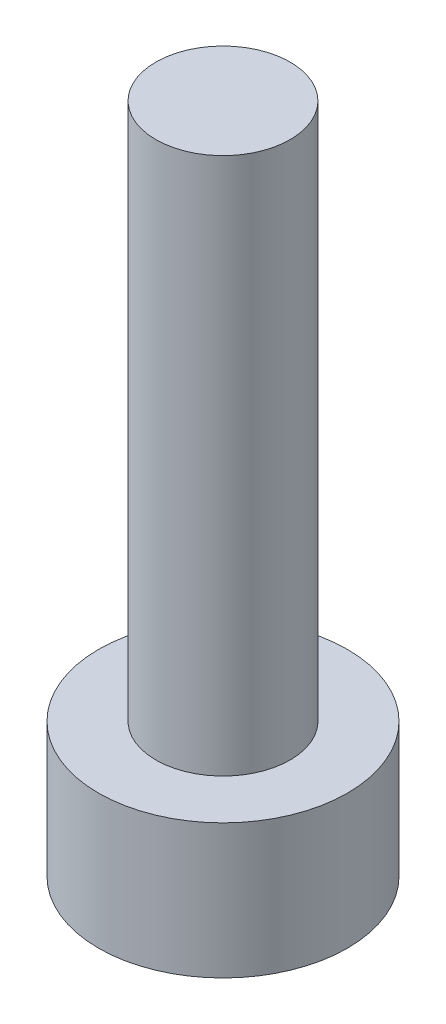
from build123d import *

# Parameters (mm, degrees)
SKETCH1_R           = 2.78
BOSS_EXTRUDE1_DEPTH = 3
SKETCH2_R           = 1.5
BOSS_EXTRUDE2_DEPTH = 12


with BuildPart() as part:
    # Sketch1 → Boss-Extrude1 (new body)
    with BuildSketch(Plane(origin=(0, 0, 0), x_dir=(1, 0, 0), z_dir=(0, 1, 0))):
        Circle(SKETCH1_R)
    extrude(amount=BOSS_EXTRUDE1_DEPTH)

    # Sketch2 → Boss-Extrude2 (add)
    with BuildSketch(Plane(origin=(0, 3, 0), x_dir=(1, 0, 0), z_dir=(0, 1, 0))):
        Circle(SKETCH2_R)
    extrude(amount=BOSS_EXTRUDE2_DEPTH)


solid = part.part
